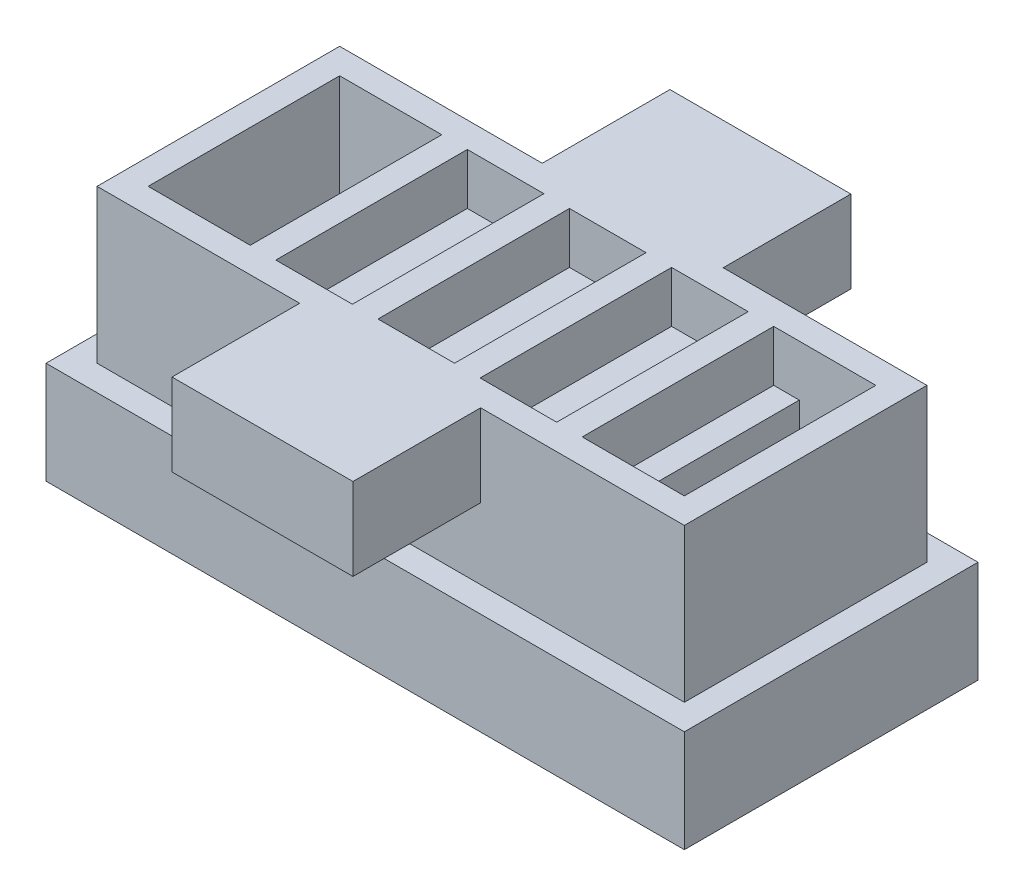
from build123d import *

# Parameters (mm, degrees)
SKETCH1_W                 = 6
SKETCH1_H                 = 15
BOSS_EXTRUDE1_DEPTH       = 15
SKETCH2_W                 = 2
SKETCH2_H                 = 11
CUT_EXTRUDE1_DEPTH        = 13
SKETCH3_W                 = 15
SKETCH3_H                 = 3
BOSS_EXTRUDE2_DEPTH       = 2
LPATTERN1_COUNT           = 5
LPATTERN1_PITCH           = 8
SKETCH6_W                 = 15
SKETCH6_H                 = 15
BOSS_EXTRUDE4_DEPTH       = 2
SKETCH8_W                 = 15
SKETCH8_H                 = 12
BOSS_EXTRUDE5_DEPTH       = 2
SKETCH9_W                 = 34
SKETCH9_H                 = 2
CUT_EXTRUDE2_DEPTH        = 1.5
SKETCH13_W                = 36
SKETCH13_H                = 13
SKETCH13_W_2              = 34
SKETCH13_H_2              = 11
BOSS_EXTRUDE9_DEPTH       = 2
SKETCH15_W                = 4
SKETCH15_H                = 2.5
BOSS_EXTRUDE10_DEPTH      = 2
LPATTERN2_COUNT           = 4
LPATTERN2_PITCH           = 8
BOSS_EXTRUDE11_DEPTH      = 5
BOSS_EXTRUDE11_DEPTH_BACK = 15
SKETCH17_W                = 46
SKETCH17_H                = 19
SPLIT2_START              = -5
SPLIT2_OUTLINE_W          = 46
SPLIT2_OUTLINE_H          = 19
SPLIT2_DEPTH              = 5
SPLIT2_2_OUTLINE_W        = 2
SPLIT2_2_OUTLINE_H        = 11
SPLIT2_2_DEPTH            = 13
SPLIT2_3_OUTLINE_W        = 6
SPLIT2_3_OUTLINE_H        = 2
SPLIT2_3_DEPTH            = 1.5
SPLIT2_START_2            = -13
SPLIT2_4_DEPTH            = 11
SPLIT2_START_3            = -17
SPLIT2_5_DEPTH            = 19
SPLIT2_6_OUTLINE_W        = 36
SPLIT2_6_OUTLINE_H        = 2
SPLIT2_6_DEPTH            = 3
SPLIT2_START_4            = -1
SPLIT2_7_OUTLINE_W        = 36
SPLIT2_7_OUTLINE_H        = 2
SPLIT2_7_DEPTH            = 3
SPLIT2_START_5            = -8.5
SPLIT2_8_DEPTH            = 2
SPLIT2_START_6            = -9.5
SPLIT2_9_OUTLINE_W        = 4
SPLIT2_9_OUTLINE_H        = 2
SPLIT2_9_DEPTH            = 4
SPLIT2_10_OUTLINE_W       = 4
SPLIT2_10_OUTLINE_H       = 2
SPLIT2_10_DEPTH           = 1
SPLIT2_START_7            = -3
SPLIT2_11_OUTLINE_W       = 4
SPLIT2_11_OUTLINE_H       = 2
SPLIT2_11_DEPTH           = 1
SKETCH18_W                = 14.174743238
SKETCH18_H                = 6.442150942
BOSS_EXTRUDE12_DEPTH      = 10
SKETCH19_W                = 50
SKETCH19_H                = 23
SKETCH19_W_2              = 46
SKETCH19_H_2              = 19
BOSS_EXTRUDE13_DEPTH      = 8
SKETCH20_W                = 2
SKETCH20_H                = 11
CUT_EXTRUDE3_DEPTH        = 5


# Read off the part's stored shape, not the designer's step: Split2
with BuildPart() as part:
    # Sketch1 → Boss-Extrude1 (new body)
    with BuildSketch(Plane(origin=(0, 0, 0), x_dir=(1, 0, 0), z_dir=(0, 1, 0))):
        with Locations((3, 7.5)):
            Rectangle(SKETCH1_W, SKETCH1_H)
    extrude(amount=BOSS_EXTRUDE1_DEPTH)

    # Sketch2 → Cut-Extrude1 (cut)
    with BuildSketch(Plane.XZ):
        with Locations((3, -7.5)):
            Rectangle(SKETCH2_W, SKETCH2_H)
    extrude(amount=-CUT_EXTRUDE1_DEPTH, mode=Mode.SUBTRACT)

    # Sketch3 → Boss-Extrude2 (add)
    with BuildSketch(Plane.ZY):
        with Locations((-7.5, 1.5)):
            Rectangle(SKETCH3_W, SKETCH3_H)
    extrude(amount=BOSS_EXTRUDE2_DEPTH)


with BuildPart() as lpattern1_1:
    # LPattern1: pattern copy
    add(part.part.moved(Location(Vector(-1, 0, 0) * (1 * LPATTERN1_PITCH))))


with BuildPart() as lpattern1_2:
    # LPattern1: pattern copy
    add(part.part.moved(Location(Vector(-1, 0, 0) * (2 * LPATTERN1_PITCH))))


with BuildPart() as lpattern1_3:
    # LPattern1: pattern copy
    add(part.part.moved(Location(Vector(-1, 0, 0) * (3 * LPATTERN1_PITCH))))


with BuildPart() as lpattern1_4:
    # LPattern1: pattern copy
    add(part.part.moved(Location(Vector(-1, 0, 0) * (4 * LPATTERN1_PITCH))))


with BuildPart() as lpattern1_1_1:
    add(lpattern1_1.part)

    # Combine1: union LPattern1_2, LPattern1_3, part, LPattern1_4
    add(lpattern1_2.part)
    add(lpattern1_3.part)
    add(part.part)
    add(lpattern1_4.part)

    # Sketch6 → Boss-Extrude4 (add)
    with BuildSketch(Plane(origin=(6, 0, 0), x_dir=(0, 0, -1), z_dir=(1, 0, 0))):
        with Locations((7.5, 7.5)):
            Rectangle(SKETCH6_W, SKETCH6_H)
    extrude(amount=BOSS_EXTRUDE4_DEPTH)

    # Sketch8 → Boss-Extrude5 (add)
    with BuildSketch(Plane.ZY.offset(32)):
        with Locations((-7.5, 9)):
            Rectangle(SKETCH8_W, SKETCH8_H)
    extrude(amount=BOSS_EXTRUDE5_DEPTH)

    # Sketch9 → Cut-Extrude2 (cut)
    with BuildSketch(Plane.XZ):
        with Locations((-13, -7.5)):
            Rectangle(SKETCH9_W, SKETCH9_H)
    extrude(amount=-CUT_EXTRUDE2_DEPTH, mode=Mode.SUBTRACT)

    # Sketch13 → Boss-Extrude9 (add)
    with BuildSketch(Plane(origin=(0, 0, 0), x_dir=(-1, 0, 0), z_dir=(0, -1, 0))):
        with Locations((13, 7.5)):
            Rectangle(SKETCH13_W, SKETCH13_H)
        with Locations((13, 7.5)):
            Rectangle(SKETCH13_W_2, SKETCH13_H_2, mode=Mode.SUBTRACT)
    extrude(amount=BOSS_EXTRUDE9_DEPTH)

    # Sketch15 → Boss-Extrude10 (add)
    with BuildSketch(Plane(origin=(0, 0, 0), x_dir=(-1, 0, 0), z_dir=(0, -1, 0))):
        with Locations((25, 4.25)):
            Rectangle(SKETCH15_W, SKETCH15_H)
        with Locations((25, 10.75)):
            Rectangle(SKETCH15_W, SKETCH15_H)
    boss_extrude10 = extrude(amount=BOSS_EXTRUDE10_DEPTH)

    # LPattern2: Boss-Extrude10 ×4
    with Locations(*[(i * LPATTERN2_PITCH, 0, 0) for i in range(1, LPATTERN2_COUNT)]):
        add(boss_extrude10)


with BuildPart() as body_2:
    # Sketch17 → Boss-Extrude11 (new, two sides: drawn at the far end of the back side and taken through both)
    with BuildSketch(Plane.XZ.offset(-BOSS_EXTRUDE11_DEPTH_BACK)):
        with Locations((-13, -7.5)):
            Rectangle(SKETCH17_W, SKETCH17_H)
    extrude(amount=BOSS_EXTRUDE11_DEPTH + BOSS_EXTRUDE11_DEPTH_BACK)

    # Combine3: cut LPattern1_1
    add(lpattern1_1_1.part, mode=Mode.SUBTRACT)

    # Split2 outline → Split2 (cut)
    with BuildSketch(Plane(origin=(0, 0, 0), x_dir=(1, 0, 0), z_dir=(0, 1, 0)).offset(SPLIT2_START)):
        with Locations((-13, 7.5)):
            Rectangle(SPLIT2_OUTLINE_W, SPLIT2_OUTLINE_H)
    extrude(amount=SPLIT2_DEPTH, mode=Mode.SUBTRACT)

    # Split2 2 outline → Split2 2 (cut)
    with BuildSketch(Plane(origin=(0, 0, 0), x_dir=(1, 0, 0), z_dir=(0, 1, 0))):
        with Locations((3, 7.5)):
            Rectangle(SPLIT2_2_OUTLINE_W, SPLIT2_2_OUTLINE_H)
        with Locations((-5, 7.5)):
            Rectangle(SPLIT2_2_OUTLINE_W, SPLIT2_2_OUTLINE_H)
        with Locations((-13, 7.5)):
            Rectangle(SPLIT2_2_OUTLINE_W, SPLIT2_2_OUTLINE_H)
        with Locations((-21, 7.5)):
            Rectangle(SPLIT2_2_OUTLINE_W, SPLIT2_2_OUTLINE_H)
        with Locations((-29, 7.5)):
            Rectangle(SPLIT2_2_OUTLINE_W, SPLIT2_2_OUTLINE_H)
    extrude(amount=SPLIT2_2_DEPTH, mode=Mode.SUBTRACT)

    # Split2 3 outline → Split2 3 (cut)
    with BuildSketch(Plane(origin=(0, 0, 0), x_dir=(1, 0, 0), z_dir=(0, 1, 0))):
        with Locations((-1, 7.5)):
            Rectangle(SPLIT2_3_OUTLINE_W, SPLIT2_3_OUTLINE_H)
        with Locations((-9, 7.5)):
            Rectangle(SPLIT2_3_OUTLINE_W, SPLIT2_3_OUTLINE_H)
        with Locations((-17, 7.5)):
            Rectangle(SPLIT2_3_OUTLINE_W, SPLIT2_3_OUTLINE_H)
        with Locations((-25, 7.5)):
            Rectangle(SPLIT2_3_OUTLINE_W, SPLIT2_3_OUTLINE_H)
    extrude(amount=SPLIT2_3_DEPTH, mode=Mode.SUBTRACT)

    # Sketch18 → Boss-Extrude12 (add)
    with BuildSketch(Plane.XY.offset(2)):
        with Locations((-13.043964225, 11.778924529)):
            Rectangle(SKETCH18_W, SKETCH18_H)
    boss_extrude12 = extrude(amount=BOSS_EXTRUDE12_DEPTH)

    # Mirror2: Boss-Extrude12 across plane
    add(boss_extrude12.mirror(Plane.XY.offset(-7.5)))


with BuildPart() as body_2_2:
    # Split2 4 outline → Split2 4 (new body)
    with BuildSketch(Plane.XY.offset(SPLIT2_START_2)):
        Polygon((-4, 0), (-4, 13), (-6, 13), (-6, 0), (-7, 0), (-7, -2), (-11, -2), (-11, 0), (-12, 0), (-12, 13), (-14, 13), (-14, 0), (-15, 0), (-15, -2), (-19, -2), (-19, 0), (-20, 0), (-20, 13), (-22, 13), (-22, 0), (-23, 0), (-23, -2), (-27, -2), (-27, 0), (-28, 0), (-28, 13), (-30, 13), (-30, -2), (-31, -2), (-31, 0), (-36, 0), (-36, -5), (10, -5), (10, 0), (5, 0), (5, -2), (4, -2), (4, 13), (2, 13), (2, 0), (1, 0), (1, -2), (-3, -2), (-3, 0), align=None)
    extrude(amount=SPLIT2_4_DEPTH)

    # Split2 5 outline → Split2 5 (add)
    with BuildSketch(Plane.XY.offset(SPLIT2_START_3)):
        Polygon((5, -2), (-31, -2), (-31, 0), (-36, 0), (-36, -5), (10, -5), (10, 0), (5, 0), align=None)
    extrude(amount=SPLIT2_5_DEPTH)

    # Split2 6 outline → Split2 6 (add)
    with BuildSketch(Plane.XY.offset(SPLIT2_START_3)):
        with Locations((-13, -1)):
            Rectangle(SPLIT2_6_OUTLINE_W, SPLIT2_6_OUTLINE_H)
    extrude(amount=SPLIT2_6_DEPTH)

    # Split2 7 outline → Split2 7 (add)
    with BuildSketch(Plane.XY.offset(SPLIT2_START_4)):
        with Locations((-13, -1)):
            Rectangle(SPLIT2_7_OUTLINE_W, SPLIT2_7_OUTLINE_H)
    extrude(amount=SPLIT2_7_DEPTH)

    # Split2 8 outline → Split2 8 (add)
    with BuildSketch(Plane.XY.offset(SPLIT2_START_5)):
        Polygon((2, 1.5), (-4, 1.5), (-4, 0), (-3, 0), (-3, -2), (1, -2), (1, 0), (2, 0), align=None)
        Polygon((-7, 0), (-6, 0), (-6, 1.5), (-12, 1.5), (-12, 0), (-11, 0), (-11, -2), (-7, -2), align=None)
        Polygon((-19, -2), (-15, -2), (-15, 0), (-14, 0), (-14, 1.5), (-20, 1.5), (-20, 0), (-19, 0), align=None)
        Polygon((-27, -2), (-23, -2), (-23, 0), (-22, 0), (-22, 1.5), (-28, 1.5), (-28, 0), (-27, 0), align=None)
    extrude(amount=SPLIT2_8_DEPTH)

    # Split2 9 outline → Split2 9 (add)
    with BuildSketch(Plane.XY.offset(SPLIT2_START_6)):
        with Locations((-1, -1)):
            Rectangle(SPLIT2_9_OUTLINE_W, SPLIT2_9_OUTLINE_H)
        with Locations((-9, -1)):
            Rectangle(SPLIT2_9_OUTLINE_W, SPLIT2_9_OUTLINE_H)
        with Locations((-17, -1)):
            Rectangle(SPLIT2_9_OUTLINE_W, SPLIT2_9_OUTLINE_H)
        with Locations((-25, -1)):
            Rectangle(SPLIT2_9_OUTLINE_W, SPLIT2_9_OUTLINE_H)
    extrude(amount=SPLIT2_9_DEPTH)

    # Split2 10 outline → Split2 10 (add)
    with BuildSketch(Plane.XY.offset(SPLIT2_START_2)):
        with Locations((-1, -1)):
            Rectangle(SPLIT2_10_OUTLINE_W, SPLIT2_10_OUTLINE_H)
        with Locations((-9, -1)):
            Rectangle(SPLIT2_10_OUTLINE_W, SPLIT2_10_OUTLINE_H)
        with Locations((-17, -1)):
            Rectangle(SPLIT2_10_OUTLINE_W, SPLIT2_10_OUTLINE_H)
        with Locations((-25, -1)):
            Rectangle(SPLIT2_10_OUTLINE_W, SPLIT2_10_OUTLINE_H)
    extrude(amount=SPLIT2_10_DEPTH)

    # Split2 11 outline → Split2 11 (add)
    with BuildSketch(Plane.XY.offset(SPLIT2_START_7)):
        with Locations((-1, -1)):
            Rectangle(SPLIT2_11_OUTLINE_W, SPLIT2_11_OUTLINE_H)
        with Locations((-9, -1)):
            Rectangle(SPLIT2_11_OUTLINE_W, SPLIT2_11_OUTLINE_H)
        with Locations((-17, -1)):
            Rectangle(SPLIT2_11_OUTLINE_W, SPLIT2_11_OUTLINE_H)
        with Locations((-25, -1)):
            Rectangle(SPLIT2_11_OUTLINE_W, SPLIT2_11_OUTLINE_H)
    extrude(amount=SPLIT2_11_DEPTH)

    # Sketch19 → Boss-Extrude13 (add)
    with BuildSketch(Plane.XZ.offset(5)):
        with Locations((-13, -7.5)):
            Rectangle(SKETCH19_W, SKETCH19_H)
        with Locations((-13, -7.5)):
            Rectangle(SKETCH19_W_2, SKETCH19_H_2, mode=Mode.SUBTRACT)
    extrude(amount=-BOSS_EXTRUDE13_DEPTH)

    # Sketch20 → Cut-Extrude3 (cut)
    with BuildSketch(Plane(origin=(0, 13, 0), x_dir=(1, 0, 0), z_dir=(0, 1, 0))):
        with Locations((-29, 7.5)):
            Rectangle(SKETCH20_W, SKETCH20_H)
    extrude(amount=-CUT_EXTRUDE3_DEPTH, mode=Mode.SUBTRACT)


solid = Compound([body_2.part, body_2_2.part])
